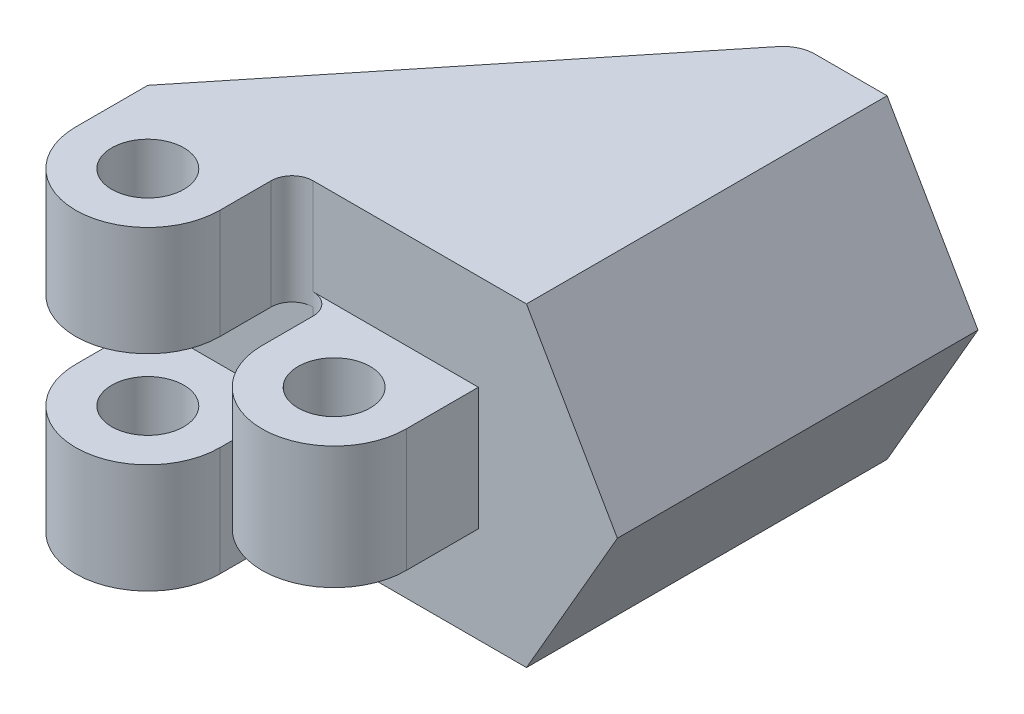
from build123d import *

# Parameters (mm, degrees)
BOSS_EXTRUDE3_DEPTH  = 6.55
BOSS_EXTRUDE4_DEPTH  = 15
BOSS_EXTRUDE5_START  = 2
SKETCH1_4_R          = 1.5
BOSS_EXTRUDE5_DEPTH  = 4.55
BOSS_EXTRUDE6_START  = -6.55
SKETCH1_6_R          = 1.5
BOSS_EXTRUDE6_DEPTH  = 4.55
SKETCH1_8_R          = 1.5
BOSS_EXTRUDE11_DEPTH = 2.55
BOSS_EXTRUDE12_START = -13.75
BOSS_EXTRUDE12_DEPTH = 3.471884434
BOSS_EXTRUDE13_START = -13.75
SKETCH4_6_R          = 1
BOSS_EXTRUDE13_DEPTH = 13.75
BOSS_EXTRUDE14_START = -13.75
SKETCH4_7_R          = 1
BOSS_EXTRUDE14_DEPTH = 4
BOSS_EXTRUDE15_START = -16.75
BOSS_EXTRUDE15_DEPTH = 1
BOSS_EXTRUDE16_START = -13.75
BOSS_EXTRUDE16_DEPTH = 1.2


# Read off the part's stored shape, not the designer's step: Boss-Extrude12
with BuildPart() as part:
    # Sketch1 → Boss-Extrude3 (new, symmetric)
    with BuildSketch(Plane(origin=(0, 0, 0), x_dir=(1, 0, 0), z_dir=(0, 1, 0))):
        with BuildLine():
            Line((-2.040057994, 14.503003078), (-13.75, 0))
            Line((-13.75, 0), (-6.875, 0))
            Line((-6.875, 0), (0, 0))
            Line((0, 0), (2, 0))
            Line((2, 0), (2, 15))
            Line((2, 15), (-1, 15))
            ThreePointArc((-1, 15), (-1.576352013, 14.869367868), (-2.040057994, 14.503003078))
        make_face()
    extrude(amount=BOSS_EXTRUDE3_DEPTH, both=True)

    # Sketch2 → Boss-Extrude4 (add)
    with BuildSketch(Plane(origin=(0, 0, -15), x_dir=(-1, 0, 0), z_dir=(0, 0, -1))):
        Polygon((-2, 6.55), (-5.781644263, 0), (-2, -6.55), align=None)
    extrude(amount=-BOSS_EXTRUDE4_DEPTH)

    # Sketch1<4> → Boss-Extrude5 (add)
    with BuildSketch(Plane(origin=(0, 0, 0), x_dir=(1, 0, 0), z_dir=(0, 1, 0)).offset(BOSS_EXTRUDE5_START)):
        with BuildLine():
            Line((-6.875, 0), (-13.75, 0))
            Line((-13.75, 0), (-13.75, -3))
            ThreePointArc((-13.75, -3), (-10.75, -6), (-7.75, -3))
            Line((-7.75, -3), (-7.75, -0.875))
            ThreePointArc((-7.75, -0.875), (-7.493718434, -0.256281566), (-6.875, 0))
        make_face()
        with Locations(Location((-10.75, -3, 0), (0, 0, 270))):
            Circle(SKETCH1_4_R, mode=Mode.SUBTRACT)
    extrude(amount=BOSS_EXTRUDE5_DEPTH)

    # Sketch1<6> → Boss-Extrude6 (add)
    with BuildSketch(Plane(origin=(0, 0, 0), x_dir=(1, 0, 0), z_dir=(0, 1, 0)).offset(BOSS_EXTRUDE6_START)):
        with BuildLine():
            Line((-6.875, 0), (-13.75, 0))
            Line((-13.75, 0), (-13.75, -3))
            ThreePointArc((-13.75, -3), (-10.75, -6), (-7.75, -3))
            Line((-7.75, -3), (-7.75, -0.875))
            ThreePointArc((-7.75, -0.875), (-7.493718434, -0.256281566), (-6.875, 0))
        make_face()
        with Locations(Location((-10.75, -3, 0), (0, 0, 270))):
            Circle(SKETCH1_6_R, mode=Mode.SUBTRACT)
    extrude(amount=BOSS_EXTRUDE6_DEPTH)

    # Sketch1<8> → Boss-Extrude11 (add, symmetric)
    with BuildSketch(Plane(origin=(0, 0, 0), x_dir=(1, 0, 0), z_dir=(0, 1, 0))):
        with BuildLine():
            Line((0, 0), (-6.875, 0))
            ThreePointArc((-6.875, 0), (-6.256281566, -0.256281566), (-6, -0.875))
            Line((-6, -0.875), (-6, -3))
            ThreePointArc((-6, -3), (-3, -6), (0, -3))
            Line((0, -3), (0, 0))
        make_face()
        with Locations(Location((-3, -3, 0), (0, 0, 270))):
            Circle(SKETCH1_8_R, mode=Mode.SUBTRACT)
    extrude(amount=BOSS_EXTRUDE11_DEPTH, both=True)

    # Boss-Extrude12 outline → Boss-Extrude12 (add)
    with BuildSketch(Plane(origin=(0, 0, 0), x_dir=(0, 0, -1), z_dir=(1, 0, 0)).offset(BOSS_EXTRUDE12_START)):
        with BuildLine():
            Line((3.4, 1), (0, 1))
            Line((0, 1), (0, -1))
            Line((0, -1), (3.4, -1))
            ThreePointArc((3.4, -1), (4.036396103, -0.736396103), (4.3, -0.1))
            Line((4.3, -0.1), (4.3, 0.1))
            ThreePointArc((4.3, 0.1), (4.036396103, 0.736396103), (3.4, 1))
        make_face()
    extrude(amount=BOSS_EXTRUDE12_DEPTH)

    # Sketch4<6> → Boss-Extrude13 (add)
    with BuildSketch(Plane(origin=(0, 0, 0), x_dir=(0, 0, -1), z_dir=(1, 0, 0)).offset(BOSS_EXTRUDE13_START)):
        with Locations((2.6, 0)):
            Circle(SKETCH4_6_R)
        with BuildLine():
            Line((2.6, -1), (0, -1))
            ThreePointArc((0, -1), (5.385677655, 0), (0, 1))
            Line((0, 1), (2.6, 1))
            Line((2.6, 1), (3.4, 1))
            ThreePointArc((3.4, 1), (4.036396103, 0.736396103), (4.3, 0.1))
            Line((4.3, 0.1), (4.3, -0.1))
            ThreePointArc((4.3, -0.1), (4.036396103, -0.736396103), (3.4, -1))
            Line((3.4, -1), (2.6, -1))
        make_face()
    extrude(amount=BOSS_EXTRUDE13_DEPTH)

    # Sketch4<7> → Boss-Extrude14 (add)
    with BuildSketch(Plane(origin=(0, 0, 0), x_dir=(0, 0, -1), z_dir=(1, 0, 0)).offset(BOSS_EXTRUDE14_START)):
        with Locations((2.6, 0)):
            Circle(SKETCH4_7_R)
    extrude(amount=-BOSS_EXTRUDE14_DEPTH)

    # Sketch4<8> → Boss-Extrude15 (add)
    with BuildSketch(Plane(origin=(0, 0, 0), x_dir=(0, 0, -1), z_dir=(1, 0, 0)).offset(BOSS_EXTRUDE15_START)):
        with BuildLine():
            ThreePointArc((3.6, 0), (3.307106781, -0.707106781), (2.6, -1))
            Line((2.6, -1), (3.4, -1))
            ThreePointArc((3.4, -1), (4.036396103, -0.736396103), (4.3, -0.1))
            Line((4.3, -0.1), (4.3, 0.1))
            ThreePointArc((4.3, 0.1), (4.036396103, 0.736396103), (3.4, 1))
            Line((3.4, 1), (2.6, 1))
            ThreePointArc((2.6, 1), (3.307106781, 0.707106781), (3.6, 0))
        make_face()
    extrude(amount=-BOSS_EXTRUDE15_DEPTH)

    # Sketch4<9> → Boss-Extrude16 (add)
    with BuildSketch(Plane(origin=(0, 0, 0), x_dir=(0, 0, -1), z_dir=(1, 0, 0)).offset(BOSS_EXTRUDE16_START)):
        with BuildLine():
            Line((0, -1), (2.6, -1))
            ThreePointArc((2.6, -1), (1.6, 0), (2.6, 1))
            Line((2.6, 1), (0, 1))
            Line((0, 1), (0, -1))
        make_face()
    extrude(amount=-BOSS_EXTRUDE16_DEPTH)


solid = part.part
